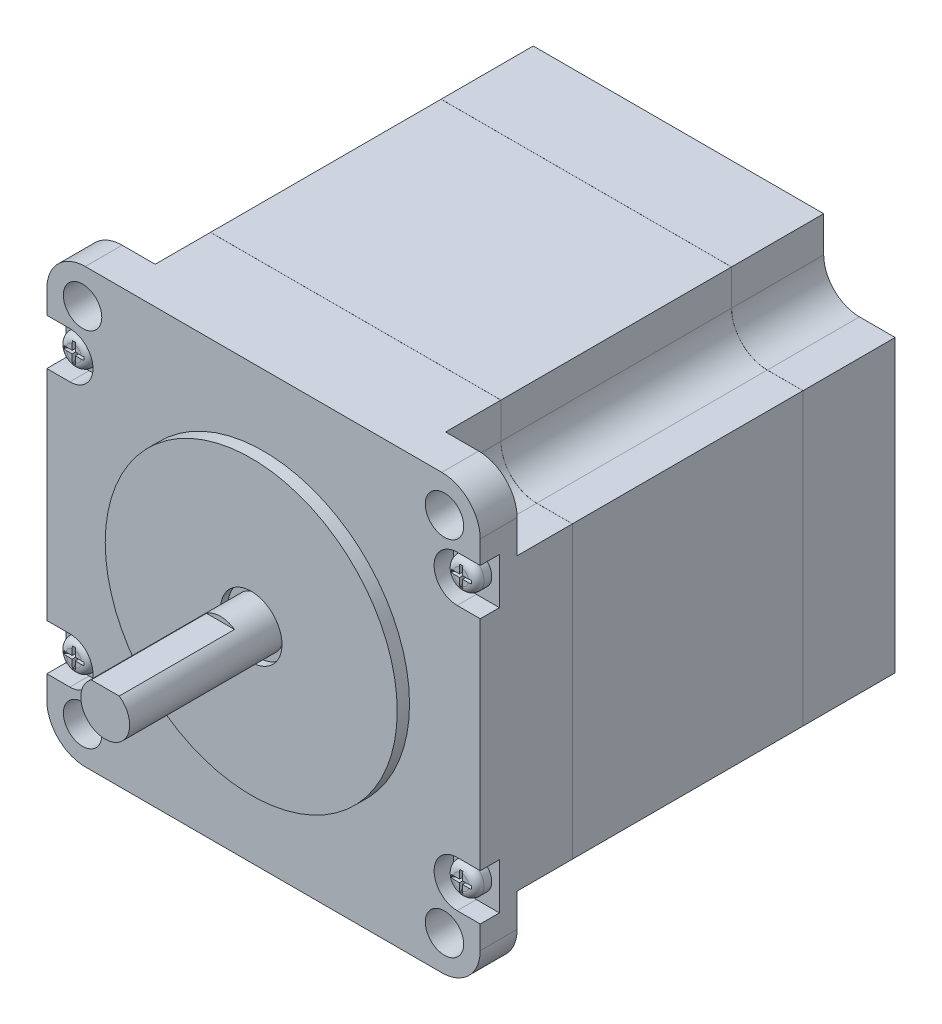
from build123d import *

# Parameters (mm, degrees)
SKETCH1_W             = 56.4
SKETCH1_H             = 56.4
BOSS_EXTRUDE1_DEPTH   = 54
SKETCH2_R             = 19
BOSS_EXTRUDE2_DEPTH   = 1.6
SKETCH3_R             = 2.5
CUT_EXTRUDE1_DEPTH    = 10
CUT_EXTRUDE2_DEPTH    = 49.2
FILLET1_R             = 5
SKETCH7_W             = 30.02
SKETCH7_H             = 56.42
SKETCH7_W_2           = 30
SKETCH7_H_2           = 56.4
CUT_EXTRUDE3_DEPTH    = 84.01927487
SKETCH8_R             = 6
CUT_EXTRUDE4_DEPTH    = 3
SKETCH9_R             = 3
BOSS_EXTRUDE3_DEPTH   = 1.5
CHAMFER1_SIZE         = 0.5
SKETCH10_R            = 4
CUT_EXTRUDE5_DEPTH    = 1
SKETCH11_R            = 3.175
BOSS_EXTRUDE4_DEPTH   = 20
CUT_EXTRUDE6_DEPTH    = 15
CUT_EXTRUDE7_DEPTH    = 2.5
SKETCH14_R            = 2
BOSS_EXTRUDE5_DEPTH   = 2
BOSS_EXTRUDE5_2_DEPTH = 2
BOSS_EXTRUDE5_3_DEPTH = 2
BOSS_EXTRUDE5_4_DEPTH = 2
FILLET2_R             = 1
FILLET3_R             = 1
FILLET4_R             = 1
FILLET5_R             = 1
CUT_EXTRUDE8_DEPTH    = 1.2
CHAMFER2_SIZE         = 1
CHAMFER3_SIZE         = 1
CHAMFER4_SIZE         = 1
CHAMFER5_SIZE         = 1


with BuildPart() as part:
    # Sketch1 → Boss-Extrude1 (new body)
    with BuildSketch(Plane.XY):
        Rectangle(SKETCH1_W, SKETCH1_H)
    extrude(amount=-BOSS_EXTRUDE1_DEPTH)

    # Sketch2 → Boss-Extrude2 (add)
    with BuildSketch(Plane.XY):
        Circle(SKETCH2_R)
    extrude(amount=BOSS_EXTRUDE2_DEPTH)

    # Sketch3 → Cut-Extrude1 (cut)
    with BuildSketch(Plane.XY):
        with Locations((-23.55, 23.55)):
            Circle(SKETCH3_R)
        with Locations((23.55, 23.55)):
            Circle(SKETCH3_R)
        with Locations((23.55, -23.55)):
            Circle(SKETCH3_R)
        with Locations((-23.55, -23.55)):
            Circle(SKETCH3_R)
    extrude(amount=-CUT_EXTRUDE1_DEPTH, mode=Mode.SUBTRACT)

    # Sketch6 → Cut-Extrude2 (cut)
    with BuildSketch(Plane(origin=(0, 0, -54), x_dir=(-1, 0, 0), z_dir=(0, 0, -1))):
        with BuildLine():
            Line((-18.9, 23.55), (-18.9, 28.2))
            Line((-18.9, 28.2), (-28.2, 28.2))
            Line((-28.2, 28.2), (-28.2, 18.9))
            Line((-28.2, 18.9), (-23.55, 18.9))
            ThreePointArc((-23.55, 18.9), (-20.261953467, 20.261953467), (-18.9, 23.55))
        make_face()
        with BuildLine():
            Line((28.2, 28.2), (28.2, 18.9))
            Line((28.2, 18.9), (23.55, 18.9))
            ThreePointArc((23.55, 18.9), (20.261953467, 20.261953467), (18.9, 23.55))
            Line((18.9, 23.55), (18.9, 28.2))
            Line((18.9, 28.2), (28.2, 28.2))
        make_face()
        with BuildLine():
            Line((-28.2, -28.2), (-28.2, -18.9))
            Line((-28.2, -18.9), (-23.55, -18.9))
            ThreePointArc((-23.55, -18.9), (-20.261953467, -20.261953467), (-18.9, -23.55))
            Line((-18.9, -23.55), (-18.9, -28.2))
            Line((-18.9, -28.2), (-28.2, -28.2))
        make_face()
        with BuildLine():
            Line((18.9, -23.55), (18.9, -28.2))
            Line((18.9, -28.2), (28.2, -28.2))
            Line((28.2, -28.2), (28.2, -18.9))
            Line((28.2, -18.9), (23.55, -18.9))
            ThreePointArc((23.55, -18.9), (20.261953467, -20.261953467), (18.9, -23.55))
        make_face()
    extrude(amount=-CUT_EXTRUDE2_DEPTH, mode=Mode.SUBTRACT)

    # Fillet1
    fillet1_edges = [part.edges().sort_by_distance(p)[0] for p in [
        (28.2, -28.2, -2.4),
        (-28.2, -28.2, -2.4),
        (-28.2, 28.2, -2.4),
        (28.2, 28.2, -2.4),
    ]]
    fillet(fillet1_edges, radius=FILLET1_R)

    # Sketch7 → Cut-Extrude3 (cut, through all)
    with BuildSketch(Plane.ZY.offset(28.2)):
        with Locations((-27, 0)):
            Rectangle(SKETCH7_W, SKETCH7_H)
        with Locations((-27, 0)):
            Rectangle(SKETCH7_W_2, SKETCH7_H_2, mode=Mode.SUBTRACT)
    extrude(amount=-CUT_EXTRUDE3_DEPTH, mode=Mode.SUBTRACT)


with BuildPart() as cut_extrude3_piece_1:
    # of the separate pieces the step leaves, piece 1, a body of its own (cut_extrude3_pieces)
    add(part.part.solids().sort_by_distance((-18.9, -28.2, -12))[0])


with BuildPart() as cut_extrude3_piece_2:
    # of the separate pieces the step leaves, piece 2, a body of its own (cut_extrude3_pieces)
    add(part.part.solids().sort_by_distance((-23.2, -28.2, 0))[0])

    # Sketch10 → Cut-Extrude5 (cut)
    with BuildSketch(Plane.XY.offset(1.6)):
        Circle(SKETCH10_R)
    extrude(amount=-CUT_EXTRUDE5_DEPTH, mode=Mode.SUBTRACT)

    # Sketch13 → Cut-Extrude7 (cut)
    with BuildSketch(Plane.XY):
        with BuildLine():
            Line((-25.2, 20.2), (-28.2, 20.2))
            Line((-28.2, 20.2), (-28.2, 14.2))
            Line((-28.2, 14.2), (-25.2, 14.2))
            ThreePointArc((-25.2, 14.2), (-22.2, 17.2), (-25.2, 20.2))
        make_face()
        with BuildLine():
            Line((28.2, 14.2), (25.2, 14.2))
            ThreePointArc((25.2, 14.2), (22.2, 17.2), (25.2, 20.2))
            Line((25.2, 20.2), (28.2, 20.2))
            Line((28.2, 20.2), (28.2, 14.2))
        make_face()
        with BuildLine():
            Line((25.2, -20.2), (28.2, -20.2))
            Line((28.2, -20.2), (28.2, -14.2))
            Line((28.2, -14.2), (25.2, -14.2))
            ThreePointArc((25.2, -14.2), (22.2, -17.2), (25.2, -20.2))
        make_face()
        with BuildLine():
            Line((-28.2, -14.2), (-25.2, -14.2))
            ThreePointArc((-25.2, -14.2), (-22.2, -17.2), (-25.2, -20.2))
            Line((-25.2, -20.2), (-28.2, -20.2))
            Line((-28.2, -20.2), (-28.2, -14.2))
        make_face()
    extrude(amount=-CUT_EXTRUDE7_DEPTH, mode=Mode.SUBTRACT)


with BuildPart() as cut_extrude3_piece_3:
    # of the separate pieces the step leaves, piece 3, a body of its own (cut_extrude3_pieces)
    add(part.part.solids().sort_by_distance((18.9, -28.2, -42.01))[0])

    # Sketch8 → Cut-Extrude4 (cut)
    with BuildSketch(Plane(origin=(0, 0, -54), x_dir=(-1, 0, 0), z_dir=(0, 0, -1))):
        Circle(SKETCH8_R)
    extrude(amount=-CUT_EXTRUDE4_DEPTH, mode=Mode.SUBTRACT)


with BuildPart() as body_4:
    # Sketch9 → Boss-Extrude3 (new body)
    with BuildSketch(Plane(origin=(0, 0, -51), x_dir=(-1, 0, 0), z_dir=(0, 0, -1))):
        Circle(SKETCH9_R)
    extrude(amount=BOSS_EXTRUDE3_DEPTH)

    # Chamfer1
    chamfer1_edges = [body_4.edges().sort_by_distance(p)[0] for p in [
        (3, 0, -52.5),
    ]]
    chamfer(chamfer1_edges, length=CHAMFER1_SIZE)


with BuildPart() as body_5:
    # Sketch11 → Boss-Extrude4 (new body)
    with BuildSketch(Plane.XY.offset(0.6)):
        Circle(SKETCH11_R)
    extrude(amount=BOSS_EXTRUDE4_DEPTH)

    # Sketch12 → Cut-Extrude6 (cut)
    with BuildSketch(Plane.XY.offset(20.6)):
        with BuildLine():
            Line((-1.822258214, 2.6), (1.822258214, 2.6))
            ThreePointArc((1.822258214, 2.6), (0, 3.175), (-1.822258214, 2.6))
        make_face()
    extrude(amount=-CUT_EXTRUDE6_DEPTH, mode=Mode.SUBTRACT)


with BuildPart() as body_6:
    # Sketch14 → Boss-Extrude5 (new body)
    with BuildSketch(Plane.XY.offset(-2.5)):
        with Locations((-25.2, 17.2)):
            Circle(SKETCH14_R)
    extrude(amount=BOSS_EXTRUDE5_DEPTH)

    # Fillet2
    fillet2_edges = [body_6.edges().sort_by_distance(p)[0] for p in [
        (-27.2, 17.2, -0.5),
    ]]
    fillet(fillet2_edges, radius=FILLET2_R)


with BuildPart() as body_7:
    # Sketch14 → Boss-Extrude5 2 (new body)
    with BuildSketch(Plane.XY.offset(-2.5)):
        with Locations((25.2, 17.2)):
            Circle(SKETCH14_R)
    extrude(amount=BOSS_EXTRUDE5_2_DEPTH)

    # Fillet5
    fillet5_edges = [body_7.edges().sort_by_distance(p)[0] for p in [
        (23.2, 17.2, -0.5),
    ]]
    fillet(fillet5_edges, radius=FILLET5_R)


with BuildPart() as body_8:
    # Sketch14 → Boss-Extrude5 3 (new body)
    with BuildSketch(Plane.XY.offset(-2.5)):
        with Locations((25.2, -17.2)):
            Circle(SKETCH14_R)
    extrude(amount=BOSS_EXTRUDE5_3_DEPTH)

    # Fillet4
    fillet4_edges = [body_8.edges().sort_by_distance(p)[0] for p in [
        (23.2, -17.2, -0.5),
    ]]
    fillet(fillet4_edges, radius=FILLET4_R)


with BuildPart() as body_9:
    # Sketch14 → Boss-Extrude5 4 (new body)
    with BuildSketch(Plane.XY.offset(-2.5)):
        with Locations((-25.2, -17.2)):
            Circle(SKETCH14_R)
    extrude(amount=BOSS_EXTRUDE5_4_DEPTH)

    # Fillet3
    fillet3_edges = [body_9.edges().sort_by_distance(p)[0] for p in [
        (-27.2, -17.2, -0.5),
    ]]
    fillet(fillet3_edges, radius=FILLET3_R)


with BuildPart() as cut_extrude8_tool:
    # Sketch15 → Cut-Extrude8 (new body)
    with BuildSketch(Plane.XY.offset(-0.5)):
        Polygon((-25.398960918, 17.403859958), (-25.398960918, 18.476027958), (-25.001039082, 18.476027958), (-25.001039082, 17.403859958), (-23.892552246, 17.403859958), (-23.892552246, 16.996140042), (-25.001039082, 16.996140042), (-25.001039082, 15.923972042), (-25.398960918, 15.923972042), (-25.398960918, 16.996140042), (-26.507447754, 16.996140042), (-26.507447754, 17.403859958), align=None)
        Polygon((25.001039082, 17.403859958), (25.001039082, 18.476027958), (25.398960918, 18.476027958), (25.398960918, 17.403859958), (26.507447754, 17.403859958), (26.507447754, 16.996140042), (25.398960918, 16.996140042), (25.398960918, 15.923972042), (25.001039082, 15.923972042), (25.001039082, 16.996140042), (23.892552246, 16.996140042), (23.892552246, 17.403859958), align=None)
        Polygon((25.398960918, -17.403859958), (25.398960918, -18.476027958), (25.001039082, -18.476027958), (25.001039082, -17.403859958), (23.892552246, -17.403859958), (23.892552246, -16.996140042), (25.001039082, -16.996140042), (25.001039082, -15.923972042), (25.398960918, -15.923972042), (25.398960918, -16.996140042), (26.507447754, -16.996140042), (26.507447754, -17.403859958), align=None)
        Polygon((-25.001039082, -17.403859958), (-25.001039082, -18.476027958), (-25.398960918, -18.476027958), (-25.398960918, -17.403859958), (-26.507447754, -17.403859958), (-26.507447754, -16.996140042), (-25.398960918, -16.996140042), (-25.398960918, -15.923972042), (-25.001039082, -15.923972042), (-25.001039082, -16.996140042), (-23.892552246, -16.996140042), (-23.892552246, -17.403859958), align=None)
    extrude(amount=-CUT_EXTRUDE8_DEPTH)


with BuildPart() as body_6_1:
    add(body_6.part)

    # Cut-Extrude8: cut by cut_extrude8_tool
    add(cut_extrude8_tool.part, mode=Mode.SUBTRACT)

    # Chamfer2
    chamfer2_edges = [body_6_1.edges().sort_by_distance(p)[0] for p in [
        (-25.2, 15.923972042, -1.7),
        (-23.892552246, 17.2, -1.7),
        (-26.507447754, 17.2, -1.7),
        (-25.2, 18.476027958, -1.7),
    ]]
    chamfer(chamfer2_edges, length=CHAMFER2_SIZE)


with BuildPart() as body_7_1:
    add(body_7.part)

    # Cut-Extrude8: cut by cut_extrude8_tool
    add(cut_extrude8_tool.part, mode=Mode.SUBTRACT)

    # Chamfer3
    chamfer3_edges = [body_7_1.edges().sort_by_distance(p)[0] for p in [
        (26.507447754, 17.2, -1.7),
        (25.2, 18.476027958, -1.7),
        (25.2, 15.923972042, -1.7),
        (23.892552246, 17.2, -1.7),
    ]]
    chamfer(chamfer3_edges, length=CHAMFER3_SIZE)


with BuildPart() as body_8_1:
    add(body_8.part)

    # Cut-Extrude8: cut by cut_extrude8_tool
    add(cut_extrude8_tool.part, mode=Mode.SUBTRACT)

    # Chamfer4
    chamfer4_edges = [body_8_1.edges().sort_by_distance(p)[0] for p in [
        (25.2, -15.923972042, -1.7),
        (25.2, -18.476027958, -1.7),
        (23.892552246, -17.2, -1.7),
        (26.507447754, -17.2, -1.7),
    ]]
    chamfer(chamfer4_edges, length=CHAMFER4_SIZE)


with BuildPart() as body_9_1:
    add(body_9.part)

    # Cut-Extrude8: cut by cut_extrude8_tool
    add(cut_extrude8_tool.part, mode=Mode.SUBTRACT)

    # Chamfer5
    chamfer5_edges = [body_9_1.edges().sort_by_distance(p)[0] for p in [
        (-23.892552246, -17.2, -1.7),
        (-26.507447754, -17.2, -1.7),
        (-25.2, -18.476027958, -1.7),
        (-25.2, -15.923972042, -1.7),
    ]]
    chamfer(chamfer5_edges, length=CHAMFER5_SIZE)


solid = Compound([cut_extrude3_piece_1.part, cut_extrude3_piece_2.part, cut_extrude3_piece_3.part, body_4.part, body_5.part, body_6_1.part, body_7_1.part, body_8_1.part, body_9_1.part])
